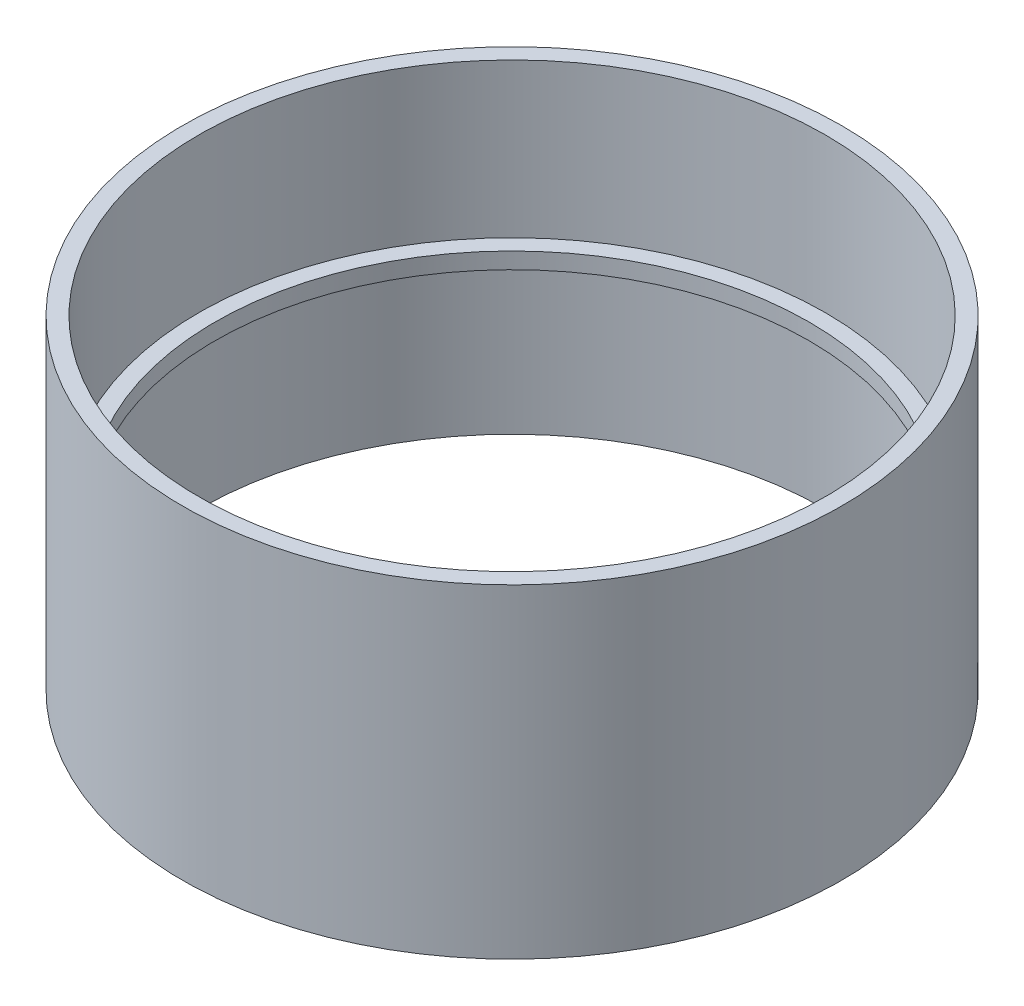
from build123d import *


with BuildPart() as part:
    # Sketch1 → Revolve1 (revolve)
    with BuildSketch(Plane.XY):
        Polygon((29, 14.25), (29, 0), (30.5, 0), (30.5, 30), (29, 30), (29, 15.75), (27.5, 15.75), (27.5, 14.25), align=None)
    revolve(axis=Axis((0, 0, 0), (0, 1, 0)))


solid = part.part
